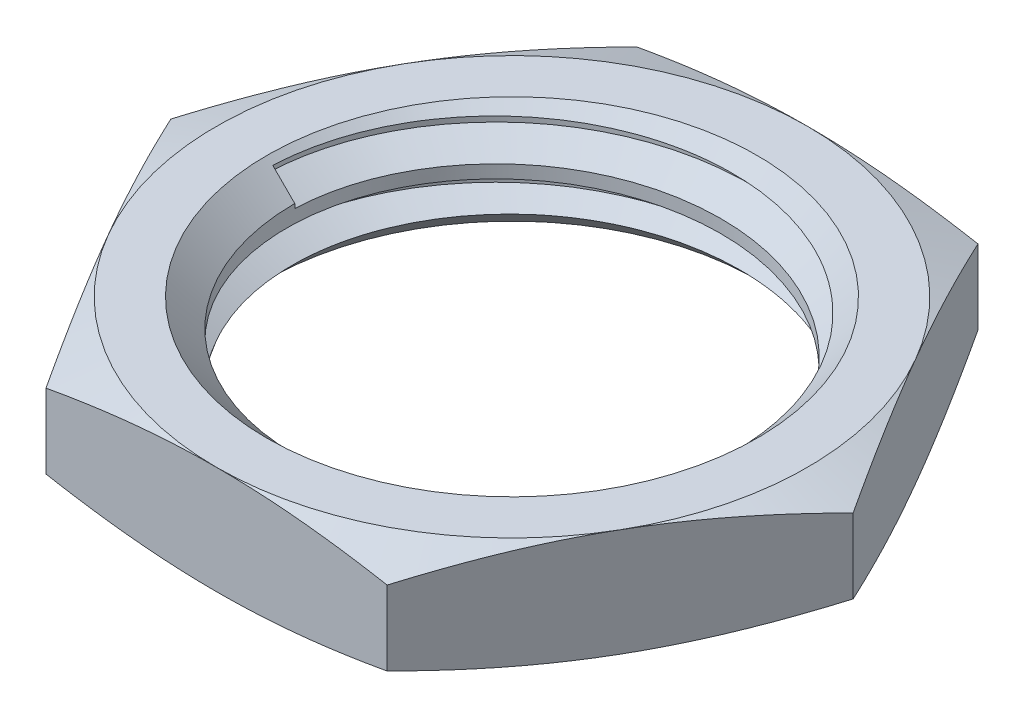
from build123d import *

# Parameters (mm, degrees)
BOSS_EXTRUDE1_DEPTH              = 3.1
SKETCH2_OUTSIDE_W                = 43.894
SKETCH2_OUTSIDE_H                = 41.264
SKETCH2_OUTSIDE_R                = 8.5
CUT_EXTRUDE1_DEPTH               = 3.1
CUT_EXTRUDE1_DRAFT               = -70
SKETCH3_OUTSIDE_W                = 43.894
SKETCH3_OUTSIDE_H                = 41.264
SKETCH3_OUTSIDE_R                = 8.5
CUT_EXTRUDE2_DEPTH               = 3.1
CUT_EXTRUDE2_DRAFT               = -70
TAP_DRILL_FOR_M14X1_5_TAP1_D     = 12.5
TAP_DRILL_FOR_M14X1_5_TAP1_DEPTH = 6.9
TAP_DRILL_FOR_M14X1_5_TAP1_TIP   = 3.755378869
CHAMFER1_SIZE                    = 0.8
CHAMFER2_SIZE                    = 0.8
THREAD1_PITCH                    = 1.5


with BuildPart() as part:
    # Sketch1 → Boss-Extrude1 (new body)
    with BuildSketch(Plane(origin=(0, 0, 0), x_dir=(1, 0, 0), z_dir=(0, 1, 0))):
        Polygon((9.814954576, 0), (4.907477288, 8.5), (-4.907477288, 8.5), (-9.814954576, 0), (-4.907477288, -8.5), (4.907477288, -8.5), align=None)
    extrude(amount=BOSS_EXTRUDE1_DEPTH)


with BuildPart() as cut_extrude1_tool:
    # Sketch2 outside → Cut-Extrude1 (with draft: the straight prism first)
    with BuildSketch(Plane(origin=(0, 3.1, 0), x_dir=(1, 0, 0), z_dir=(0, 1, 0))):
        Rectangle(SKETCH2_OUTSIDE_W, SKETCH2_OUTSIDE_H)
        Circle(SKETCH2_OUTSIDE_R, mode=Mode.SUBTRACT)
    extrude(amount=-CUT_EXTRUDE1_DEPTH)
    # Cut-Extrude1: the draft: its side faces are tilted about the plane it starts from
    cut_extrude1_sides = [cut_extrude1_tool.faces().sort_by_distance(p)[0] for p in [
        (0, 1.55, 20.632),
        (21.947, 1.55, 0),
        (0, 1.55, -20.632),
        (-21.947, 1.55, 0),
        (-8.5, 1.55, 0),
    ]]
    draft(cut_extrude1_sides, Plane(origin=(0, 3.1, 0), x_dir=(1, 0, 0), z_dir=(0, 1, 0)), CUT_EXTRUDE1_DRAFT)


with BuildPart() as part_1:
    add(part.part)

    # Cut-Extrude1: cut by cut_extrude1_tool
    add(cut_extrude1_tool.part, mode=Mode.SUBTRACT)


with BuildPart() as cut_extrude2_tool:
    # Sketch3 outside → Cut-Extrude2 (with draft: the straight prism first)
    with BuildSketch(Plane.XZ):
        Rectangle(SKETCH3_OUTSIDE_W, SKETCH3_OUTSIDE_H)
        Circle(SKETCH3_OUTSIDE_R, mode=Mode.SUBTRACT)
    extrude(amount=-CUT_EXTRUDE2_DEPTH)
    # Cut-Extrude2: the draft: its side faces are tilted about the plane it starts from
    cut_extrude2_sides = [cut_extrude2_tool.faces().sort_by_distance(p)[0] for p in [
        (0, 1.55, -20.632),
        (21.947, 1.55, 0),
        (0, 1.55, 20.632),
        (-21.947, 1.55, 0),
        (-8.5, 1.55, 0),
    ]]
    draft(cut_extrude2_sides, Plane.XZ, CUT_EXTRUDE2_DRAFT)


with BuildPart() as part_2:
    add(part_1.part)

    # Cut-Extrude2: cut by cut_extrude2_tool
    add(cut_extrude2_tool.part, mode=Mode.SUBTRACT)

    # Tap Drill for M14x1.5 Tap1
    with Locations(Plane(origin=(0, 3.1, 0), x_dir=(1, 0, 0), z_dir=(0, 1, 0))):
        with Locations((0, 0)):
            Hole(TAP_DRILL_FOR_M14X1_5_TAP1_D / 2, depth=TAP_DRILL_FOR_M14X1_5_TAP1_DEPTH)
            with Locations((0, 0, -(TAP_DRILL_FOR_M14X1_5_TAP1_DEPTH + TAP_DRILL_FOR_M14X1_5_TAP1_TIP / 2))):  # 118° drill point
                Cone(0, TAP_DRILL_FOR_M14X1_5_TAP1_D / 2, TAP_DRILL_FOR_M14X1_5_TAP1_TIP, mode=Mode.SUBTRACT)

    # Chamfer1
    chamfer1_edges = [part_2.edges().sort_by_distance(p)[0] for p in [
        (6.25, 3.1, 0),
    ]]
    chamfer(chamfer1_edges, length=CHAMFER1_SIZE)

    # Chamfer2
    chamfer2_edges = [part_2.edges().sort_by_distance(p)[0] for p in [
        (6.25, 0, 0),
    ]]
    chamfer(chamfer2_edges, length=CHAMFER2_SIZE)

    # Thread1: the profile of Thread Profile1 profile screwed along a right-hand helix of 2.333333 turns, 8 arcs to a turn; built about Z, then put on its axis
    thread1_z = Axis((0, 0, 0), (0, 0, 1))
    thread1_corners = [(6.2497, 0, -0.000173205), (7.061898812, 0, 0.468749998), (7.061898812, 0, 0.656249998), (6.2497, 0, 1.125173201)]
    with BuildLine(mode=Mode.PRIVATE) as thread1_profile:
        Line(thread1_corners[0], thread1_corners[1])
        Line(thread1_corners[1], thread1_corners[2])
        Line(thread1_corners[2], thread1_corners[3])
        Line(thread1_corners[3], thread1_corners[0])
    thread1_cap = Face(thread1_profile.wire())
    thread1_turn_angles = [0, 22.5, 45, 67.5, 90, 112.5, 135, 157.5, 180, 202.5, 225, 247.5, 270, 292.5, 315, 337.5, 360]
    thread1_turn_weights = [1, 0.9238795325112867, 1, 0.9238795325112867, 1, 0.9238795325112867, 1, 0.9238795325112867, 1, 0.9238795325112867, 1, 0.9238795325112867, 1, 0.9238795325112867, 1, 0.9238795325112867, 1]
    thread1_turn_rails = [Edge.make_bspline([Vector(p[0], p[1], 0).rotate(thread1_z, thread1_turn_angles[k]) / thread1_turn_weights[k] + Vector(0, 0, p[2] + THREAD1_PITCH * thread1_turn_angles[k] / 360) for k in range(17)], [0, 0, 0, 1, 1, 2, 2, 3, 3, 4, 4, 5, 5, 6, 6, 7, 7, 8, 8, 8], 2, thread1_turn_weights) for p in thread1_corners]
    thread1_turn_sides = [Face.make_surface_from_curves(thread1_turn_rails[p[0]], thread1_turn_rails[p[1]]) for p in [(0, 1), (1, 2), (2, 3), (3, 0)]]
    thread1_last_angles = [720, 742.5, 765, 787.5, 810, 825, 840]
    thread1_last_weights = [1, 0.9238795325112867, 1, 0.9238795325112867, 1, 0.9659258262890709, 1]
    thread1_last_rails = [Edge.make_bspline([Vector(p[0], p[1], 0).rotate(thread1_z, thread1_last_angles[k]) / thread1_last_weights[k] + Vector(0, 0, p[2] + THREAD1_PITCH * thread1_last_angles[k] / 360) for k in range(7)], [0, 0, 0, 1, 1, 2, 2, 3, 3, 3], 2, thread1_last_weights) for p in thread1_corners]
    thread1_last_sides = [Face.make_surface_from_curves(thread1_last_rails[p[0]], thread1_last_rails[p[1]]) for p in [(0, 1), (1, 2), (2, 3), (3, 0)]]
    thread1 = Plane(origin=(0, 3.3, 0), x_dir=(-1, 0, 0), z_dir=(0, -1, 0)) * Solid(Shell([*[p.moved(Location((0, 0, THREAD1_PITCH * i))) for i in range(2) for p in thread1_turn_sides], *thread1_last_sides, thread1_cap, thread1_cap.rotate(thread1_z, 840).moved(Location((0, 0, THREAD1_PITCH * 840 / 360)))]))
    add(thread1, mode=Mode.SUBTRACT)


solid = part_2.part
